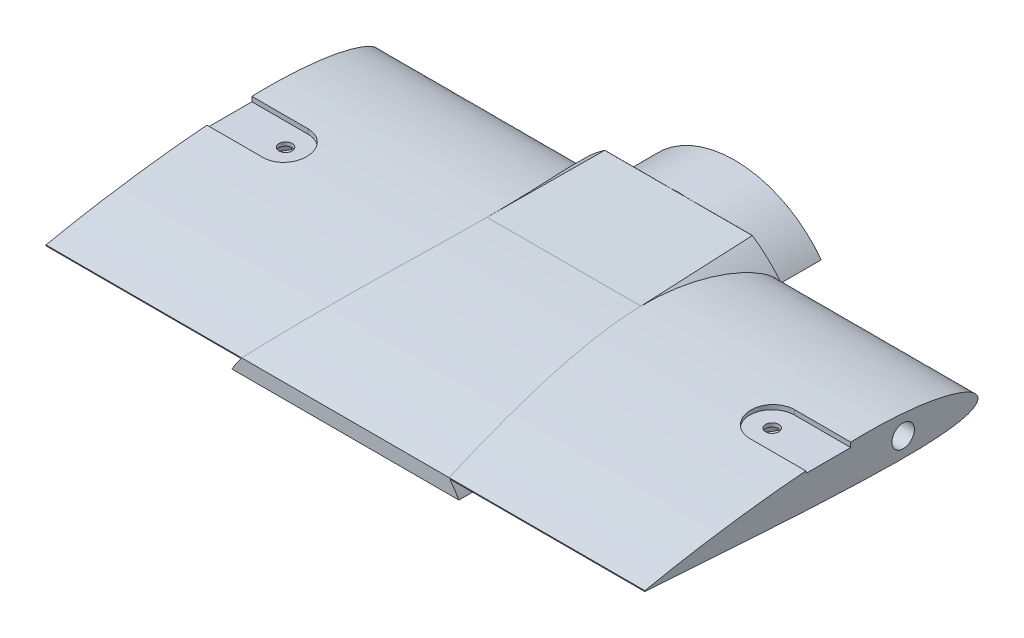
from build123d import *

# Parameters (mm, degrees)
EXTERIOR_DEPTH      = 89
BOSS_EXTRUDE1_DEPTH = 15
CUT_EXTRUDE1_DEPTH  = 187.402789831
SKETCH13_R          = 3
CUT_EXTRUDE2_DEPTH  = 160
CUT_EXTRUDE3_DEPTH  = 3
SKETCH15_R          = 1.75
CUT_EXTRUDE4_DEPTH  = 4
CUT_EXTRUDE5_DEPTH  = 2.5


with BuildPart() as part:
    # Sketch4 → Exterior (new body)
    with BuildSketch(Plane.XY):
        with BuildLine():
            Line((-30.310889132, 17.5), (30.310889132, 17.5))
            ThreePointArc((30.310889132, 17.5), (0, 35), (-30.310889132, 17.5))
        make_face()
    extrude(amount=EXTERIOR_DEPTH)

    # Sketch5 → Boss-Extrude1 (add)
    with BuildSketch(Plane(origin=(0, 0, 0), x_dir=(-1, 0, 0), z_dir=(0, 0, -1))):
        with BuildLine():
            Line((23.12466216, 17.5), (-23.12466216, 17.5))
            ThreePointArc((-23.12466216, 17.5), (0, 29), (23.12466216, 17.5))
        make_face()
    extrude(amount=BOSS_EXTRUDE1_DEPTH)

    # Sketch8 → Loft9 section 0
    with BuildSketch(Plane(origin=(80, 0, 0), x_dir=(0, 0, -1), z_dir=(1, 0, 0))):
        with BuildLine():
            Line((-89, 21.388673285), (-89, 21.157289024))
            add(Edge.make_bspline(
                [(-89, 21.388673285), (-87.517590216, 21.692439314), (-84.55666408, 22.299173554), (-78.629726947, 23.410490963), (-71.217063181, 24.641831569), (-62.315979948, 25.916239067), (-53.416365024, 26.979047829), (-44.512891772, 27.757252313), (-35.611446145, 28.284249753), (-28.184700481, 28.373454674), (-22.249157522, 28.127729724), (-17.793860325, 27.767671666), (-13.332938365, 27.197496306), (-9.62034211, 26.495369454), (-6.660587516, 25.701015566), (-4.416675535, 24.978830377), (-2.51552544, 24.137376162), (-0.875610556, 23.117206005), (0.554450875, 21.352966349), (-0.931001928, 19.802231536), (-2.540242561, 19.094955092), (-4.433028592, 18.557703614), (-6.669552992, 18.172492853), (-9.641153104, 17.843758377), (-13.350431468, 17.590735708), (-17.804318711, 17.489291467), (-22.255027214, 17.503428063), (-28.18850674, 17.634400274), (-35.606048519, 17.870077207), (-44.505998121, 18.280226492), (-53.403367011, 18.813318665), (-62.302244976, 19.367425301), (-71.202644497, 19.928300878), (-78.617203737, 20.444864827), (-84.55068004, 20.843300056), (-87.516825449, 21.052621243), (-89, 21.157289024)],
                knots=[0, 0, 0, 0, 0.02501249, 0.049959286, 0.099672925, 0.14920632, 0.198581097, 0.24780517, 0.296916575, 0.345952722, 0.370491626, 0.395091204, 0.419814796, 0.444798575, 0.457489819, 0.470406405, 0.483879409, 0.49126412, 0.503458853, 0.513609129, 0.520450991, 0.533235388, 0.545691039, 0.558031884, 0.582609167, 0.607134742, 0.63165208, 0.656174272, 0.705233949, 0.754320379, 0.803437364, 0.852566096, 0.901700994, 0.950848809, 0.975422717, 1, 1, 1, 1], degree=3))
        make_face()
    # Sketch9 → Loft9 section 1
    with BuildSketch(Plane(origin=(-80, 0, 0), x_dir=(0, 0, -1), z_dir=(1, 0, 0))):
        with BuildLine():
            Line((-89, 21.388673285), (-89, 21.157289024))
            add(Edge.make_bspline(
                [(-89, 21.388673285), (-87.517590216, 21.692439314), (-84.55666408, 22.299173554), (-78.629726947, 23.410490963), (-71.217063181, 24.641831569), (-62.315979948, 25.916239067), (-53.416365024, 26.979047829), (-44.512891772, 27.757252313), (-35.611446145, 28.284249753), (-28.184700481, 28.373454674), (-22.249157522, 28.127729724), (-17.793860325, 27.767671666), (-13.332938365, 27.197496306), (-9.62034211, 26.495369454), (-6.660587516, 25.701015566), (-4.416675535, 24.978830377), (-2.51552544, 24.137376162), (-0.875610556, 23.117206005), (0.554450875, 21.352966349), (-0.931001928, 19.802231536), (-2.540242561, 19.094955092), (-4.433028592, 18.557703614), (-6.669552992, 18.172492853), (-9.641153104, 17.843758377), (-13.350431468, 17.590735708), (-17.804318711, 17.489291467), (-22.255027214, 17.503428063), (-28.18850674, 17.634400274), (-35.606048519, 17.870077207), (-44.505998121, 18.280226492), (-53.403367011, 18.813318665), (-62.302244976, 19.367425301), (-71.202644497, 19.928300878), (-78.617203737, 20.444864827), (-84.55068004, 20.843300056), (-87.516825449, 21.052621243), (-89, 21.157289024)],
                knots=[0, 0, 0, 0, 0.02501249, 0.049959286, 0.099672925, 0.14920632, 0.198581097, 0.24780517, 0.296916575, 0.345952722, 0.370491626, 0.395091204, 0.419814796, 0.444798575, 0.457489819, 0.470406405, 0.483879409, 0.49126412, 0.503458853, 0.513609129, 0.520450991, 0.533235388, 0.545691039, 0.558031884, 0.582609167, 0.607134742, 0.63165208, 0.656174272, 0.705233949, 0.754320379, 0.803437364, 0.852566096, 0.901700994, 0.950848809, 0.975422717, 1, 1, 1, 1], degree=3))
        make_face()
    loft()

    # Sketch12 → Cut-Extrude1 (cut, through all)
    with BuildSketch(Plane(origin=(80, 0, 0), x_dir=(0, 0, -1), z_dir=(1, 0, 0))):
        with BuildLine():
            Line((-89, 21.388673285), (-97.240851338, 26.906548897))
            Line((-97.240851338, 26.906548897), (-90.292288108, 42.772216923))
            Line((-90.292288108, 42.772216923), (-30.113825381, 44.023328414))
            Line((-30.113825381, 44.023328414), (6.418630162, 38.518437853))
            Line((6.418630162, 38.518437853), (-0.009919735, 28.917510296))
            Line((-0.009919735, 28.917510296), (-30.620155213, 28.319719466))
            add(Edge.make_bspline(
                [(-89, 21.388673285), (-87.517590216, 21.692439314), (-84.55666408, 22.299173554), (-78.629726947, 23.410490963), (-71.217063181, 24.641831569), (-62.315979948, 25.916239067), (-53.416365024, 26.979047829), (-44.512891772, 27.757252313), (-36.914651442, 28.207095335), (-32.281666301, 28.310724955), (-30.620155213, 28.319719466)],
                knots=[0, 0, 0, 0, 0.02501249, 0.049959286, 0.099672925, 0.14920632, 0.198581097, 0.24780517, 0.296916575, 0.324376959, 0.324376959, 0.324376959, 0.324376959], degree=3))
        make_face()
    extrude(amount=-CUT_EXTRUDE1_DEPTH, mode=Mode.SUBTRACT)

    # Sketch13 → Cut-Extrude2 (cut)
    with BuildSketch(Plane.ZY.offset(80)):
        with Locations((20, 22.719194586)):
            Circle(SKETCH13_R)
    extrude(amount=-CUT_EXTRUDE2_DEPTH, mode=Mode.SUBTRACT)

    # Sketch14 → Cut-Extrude3 (cut)
    with BuildSketch(Plane(origin=(0, 30, 0), x_dir=(1, 0, 0), z_dir=(0, 1, 0))):
        with BuildLine():
            Line((-65, -33.999999014), (-80, -33.999999014))
            Line((-80, -33.999999014), (-80, -45.999999014))
            Line((-80, -45.999999014), (-65, -45.999999014))
            ThreePointArc((-65, -45.999999014), (-59, -39.999999014), (-65, -33.999999014))
        make_face()
        with BuildLine():
            Line((-80, -33.999999014), (-95, -33.999999014))
            ThreePointArc((-95, -33.999999014), (-101, -39.999999014), (-95, -45.999999014))
            Line((-95, -45.999999014), (-80, -45.999999014))
            Line((-80, -45.999999014), (-80, -33.999999014))
        make_face()
    cut_extrude3 = extrude(amount=-CUT_EXTRUDE3_DEPTH, mode=Mode.SUBTRACT)

    # Sketch15 → Cut-Extrude4 (cut)
    with BuildSketch(Plane(origin=(0, 27, 0), x_dir=(1, 0, 0), z_dir=(0, 1, 0))):
        with Locations(Location((-65, -39.999999014, 0), (0, 0, 270))):
            Circle(SKETCH15_R)
    cut_extrude4 = extrude(amount=-CUT_EXTRUDE4_DEPTH, mode=Mode.SUBTRACT)

    # Sketch16 → Cut-Extrude5 (cut)
    with BuildSketch(Plane(origin=(0, 23.5, 0), x_dir=(1, 0, 0), z_dir=(0, 1, 0))):
        Polygon((-67.165063509, -43.749999014), (-62.834936491, -43.749999014), (-60.669872981, -39.999999014), (-62.834936491, -36.249999014), (-67.165063509, -36.249999014), (-69.330127019, -39.999999014), align=None)
    cut_extrude5 = extrude(amount=CUT_EXTRUDE5_DEPTH, mode=Mode.SUBTRACT)

    # Mirror1: Cut-Extrude3, Cut-Extrude4, Cut-Extrude5 across plane
    add(cut_extrude3.mirror(Plane(origin=(0, 0, 0), x_dir=(0, 0, 1), z_dir=(1, 0, 0))), mode=Mode.SUBTRACT)
    add(cut_extrude4.mirror(Plane(origin=(0, 0, 0), x_dir=(0, 0, 1), z_dir=(1, 0, 0))), mode=Mode.SUBTRACT)
    add(cut_extrude5.mirror(Plane(origin=(0, 0, 0), x_dir=(0, 0, 1), z_dir=(1, 0, 0))), mode=Mode.SUBTRACT)


solid = part.part
